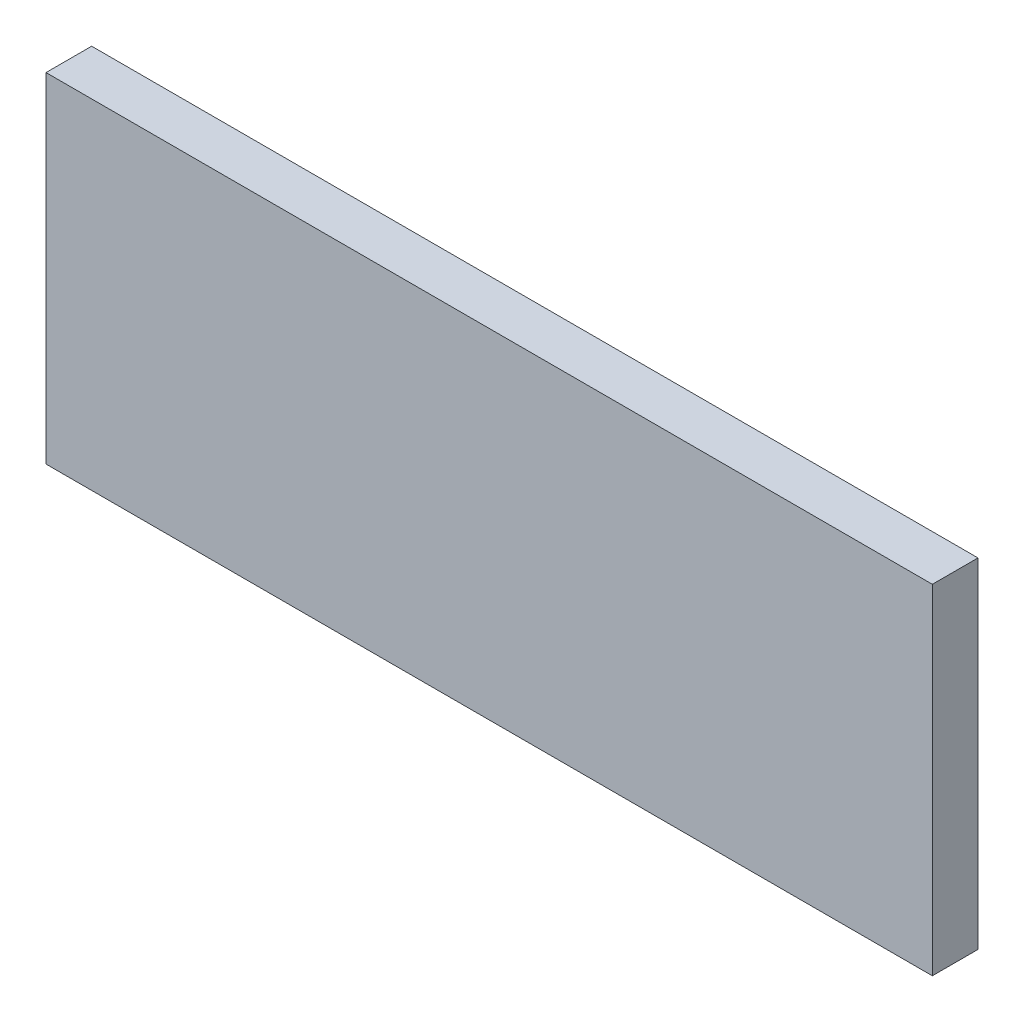
from build123d import *

# Parameters (mm, degrees)
SKETCH2_W           = 92.456
SKETCH2_H           = 35.3695
BOSS_EXTRUDE1_DEPTH = 4.7625


with BuildPart() as part:
    # Sketch2 → Boss-Extrude1 (new body)
    with BuildSketch(Plane.XY):
        Rectangle(SKETCH2_W, SKETCH2_H)
    extrude(amount=BOSS_EXTRUDE1_DEPTH)


solid = part.part
